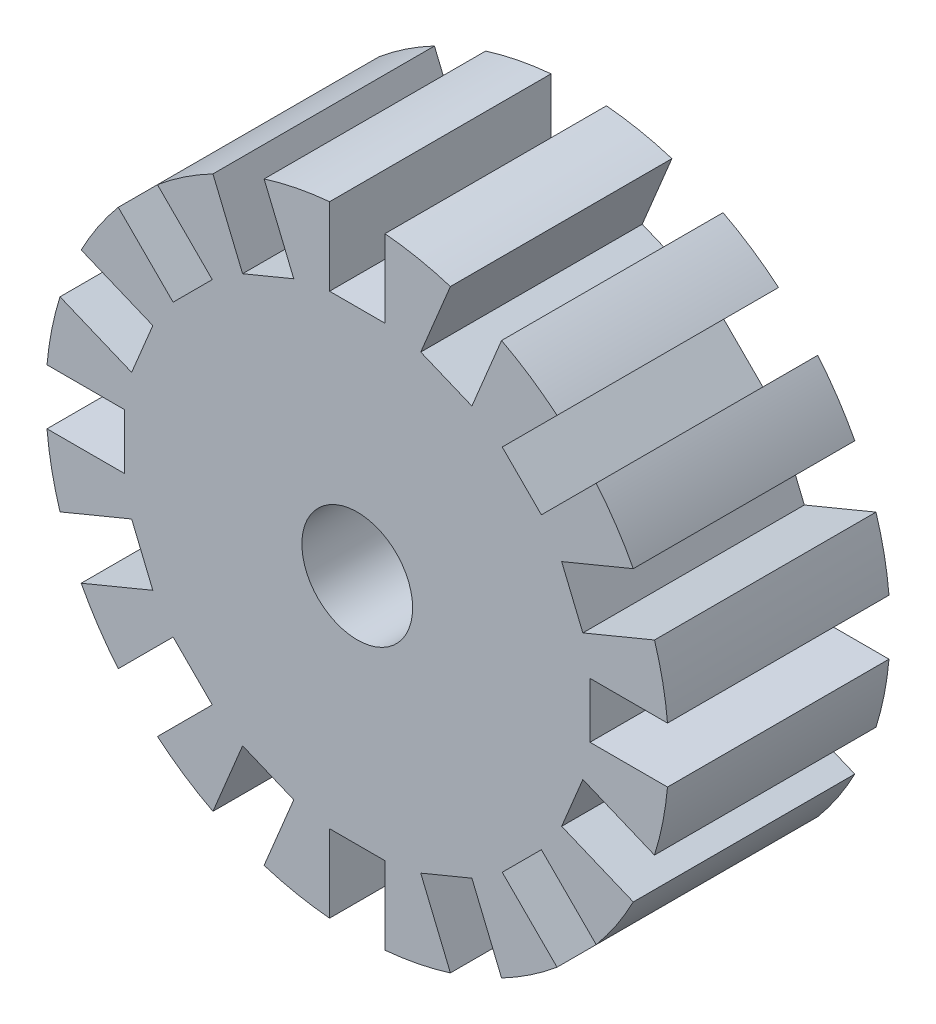
from build123d import *

# Parameters (mm, degrees)
SKETCH1_R               = 11.25
BOSS_EXTRUDE1_DEPTH     = 4
SKETCH2_W               = 2
SKETCH2_H               = 2.8
CUT_EXTRUDE2_DEPTH      = 18.808003819
CIRPATTERN1_START       = -4
CIRPATTERN1_DEPTH       = 8
CUT_EXTRUDE3_DEPTH      = 18.751760477
CUT_EXTRUDE3_DEPTH_BACK = 18.751760477
SKETCH4_R               = 2


# Read off the part's stored shape, not the designer's step: CirPattern1
with BuildPart() as part:
    # Sketch1 → Boss-Extrude1 (new, symmetric)
    with BuildSketch(Plane.XY):
        Circle(SKETCH1_R)
    extrude(amount=BOSS_EXTRUDE1_DEPTH, both=True)

    # Sketch2 → Cut-Extrude2 (cut, symmetric)
    with BuildSketch(Plane.XY.offset(4)):
        with Locations((0, 9.805467416)):
            Rectangle(SKETCH2_W, SKETCH2_H)
    extrude(amount=CUT_EXTRUDE2_DEPTH, both=True, mode=Mode.SUBTRACT)


with BuildPart() as cut_extrude2_kept_piece:
    # of the separate pieces the step leaves, the one the design keeps (cut_extrude2_pieces_kept)
    add(part.part.solids().sort_by_distance((1, 8.405467416, 4))[0])

    # CirPattern1 outline → CirPattern1 (cut)
    with BuildSketch(Plane.XY.offset(CIRPATTERN1_START)):
        with BuildLine():
            Line((1, -8.405467416), (-1, -8.405467416))
            Line((-1, -8.405467416), (-1, -11.205467416))
            ThreePointArc((-1, -11.205467416), (0, -11.25), (1, -11.205467416))
            Line((1, -11.205467416), (1, -8.405467416))
        make_face()
        with BuildLine():
            Line((4.140512654, 7.382955874), (5.212026264, 9.969818566))
            ThreePointArc((5.212026264, 9.969818566), (4.305188614, 10.393644741), (3.364267199, 10.73518543))
            Line((3.364267199, 10.73518543), (2.292753589, 8.148322739))
            Line((2.292753589, 8.148322739), (4.140512654, 7.382955874))
        make_face()
        with BuildLine():
            Line((6.65066979, 5.236456227), (8.630568777, 7.216355215))
            ThreePointArc((8.630568777, 7.216355215), (7.954951289, 7.954951289), (7.216355215, 8.630568777))
            Line((7.216355215, 8.630568777), (5.236456227, 6.65066979))
            Line((5.236456227, 6.65066979), (6.65066979, 5.236456227))
        make_face()
        with BuildLine():
            Line((8.148322739, 2.292753589), (10.73518543, 3.364267199))
            ThreePointArc((10.73518543, 3.364267199), (10.393644741, 4.305188614), (9.969818565, 5.212026264))
            Line((9.969818565, 5.212026264), (7.382955874, 4.140512654))
            Line((7.382955874, 4.140512654), (8.148322739, 2.292753589))
        make_face()
        with BuildLine():
            Line((8.405467416, -1), (11.205467416, -1))
            ThreePointArc((11.205467416, -1), (11.25, 0), (11.205467416, 1))
            Line((11.205467416, 1), (8.405467416, 1))
            Line((8.405467416, 1), (8.405467416, -1))
        make_face()
        with BuildLine():
            Line((7.382955874, -4.140512654), (9.969818565, -5.212026264))
            ThreePointArc((9.969818565, -5.212026264), (10.393644741, -4.305188614), (10.73518543, -3.364267199))
            Line((10.73518543, -3.364267199), (8.148322739, -2.292753589))
            Line((8.148322739, -2.292753589), (7.382955874, -4.140512654))
        make_face()
        with BuildLine():
            Line((5.236456227, -6.65066979), (7.216355215, -8.630568777))
            ThreePointArc((7.216355215, -8.630568777), (7.954951288, -7.954951288), (8.630568777, -7.216355215))
            Line((8.630568777, -7.216355215), (6.65066979, -5.236456227))
            Line((6.65066979, -5.236456227), (5.236456227, -6.65066979))
        make_face()
        with BuildLine():
            Line((2.292753589, -8.148322739), (3.364267199, -10.73518543))
            ThreePointArc((3.364267199, -10.73518543), (4.305188614, -10.393644741), (5.212026264, -9.969818565))
            Line((5.212026264, -9.969818565), (4.140512654, -7.382955874))
            Line((4.140512654, -7.382955874), (2.292753589, -8.148322739))
        make_face()
        with BuildLine():
            ThreePointArc((-3.364267199, 10.73518543), (-4.305188614, 10.393644741), (-5.212026264, 9.969818566))
            Line((-5.212026264, 9.969818566), (-4.140512654, 7.382955874))
            Line((-4.140512654, 7.382955874), (-2.292753589, 8.148322739))
            Line((-2.292753589, 8.148322739), (-3.364267199, 10.73518543))
        make_face()
        with BuildLine():
            ThreePointArc((-7.216355215, 8.630568777), (-7.954951289, 7.954951289), (-8.630568777, 7.216355215))
            Line((-8.630568777, 7.216355215), (-6.65066979, 5.236456227))
            Line((-6.65066979, 5.236456227), (-5.236456227, 6.65066979))
            Line((-5.236456227, 6.65066979), (-7.216355215, 8.630568777))
        make_face()
        with BuildLine():
            ThreePointArc((-9.969818565, 5.212026264), (-10.393644741, 4.305188614), (-10.73518543, 3.364267199))
            Line((-10.73518543, 3.364267199), (-8.148322739, 2.292753589))
            Line((-8.148322739, 2.292753589), (-7.382955874, 4.140512654))
            Line((-7.382955874, 4.140512654), (-9.969818565, 5.212026264))
        make_face()
        with BuildLine():
            ThreePointArc((-11.205467416, 1), (-11.25, 0), (-11.205467416, -1))
            Line((-11.205467416, -1), (-8.405467416, -1))
            Line((-8.405467416, -1), (-8.405467416, 1))
            Line((-8.405467416, 1), (-11.205467416, 1))
        make_face()
        with BuildLine():
            ThreePointArc((-10.73518543, -3.364267199), (-10.393644741, -4.305188614), (-9.969818565, -5.212026264))
            Line((-9.969818565, -5.212026264), (-7.382955874, -4.140512654))
            Line((-7.382955874, -4.140512654), (-8.148322739, -2.292753589))
            Line((-8.148322739, -2.292753589), (-10.73518543, -3.364267199))
        make_face()
        with BuildLine():
            ThreePointArc((-8.630568777, -7.216355215), (-7.954951288, -7.954951288), (-7.216355215, -8.630568777))
            Line((-7.216355215, -8.630568777), (-5.236456227, -6.65066979))
            Line((-5.236456227, -6.65066979), (-6.65066979, -5.236456227))
            Line((-6.65066979, -5.236456227), (-8.630568777, -7.216355215))
        make_face()
        with BuildLine():
            ThreePointArc((-5.212026264, -9.969818565), (-4.305188614, -10.393644741), (-3.364267199, -10.73518543))
            Line((-3.364267199, -10.73518543), (-2.292753589, -8.148322739))
            Line((-2.292753589, -8.148322739), (-4.140512654, -7.382955874))
            Line((-4.140512654, -7.382955874), (-5.212026264, -9.969818565))
        make_face()
    extrude(amount=CIRPATTERN1_DEPTH, mode=Mode.SUBTRACT)

    # Sketch4 → Cut-Extrude3 (cut, two sides: drawn at the far end of the back side and taken through both)
    with BuildSketch(Plane.XY.offset(4).offset(-CUT_EXTRUDE3_DEPTH_BACK)):
        Circle(SKETCH4_R)
    extrude(amount=CUT_EXTRUDE3_DEPTH + CUT_EXTRUDE3_DEPTH_BACK, mode=Mode.SUBTRACT)


solid = cut_extrude2_kept_piece.part
